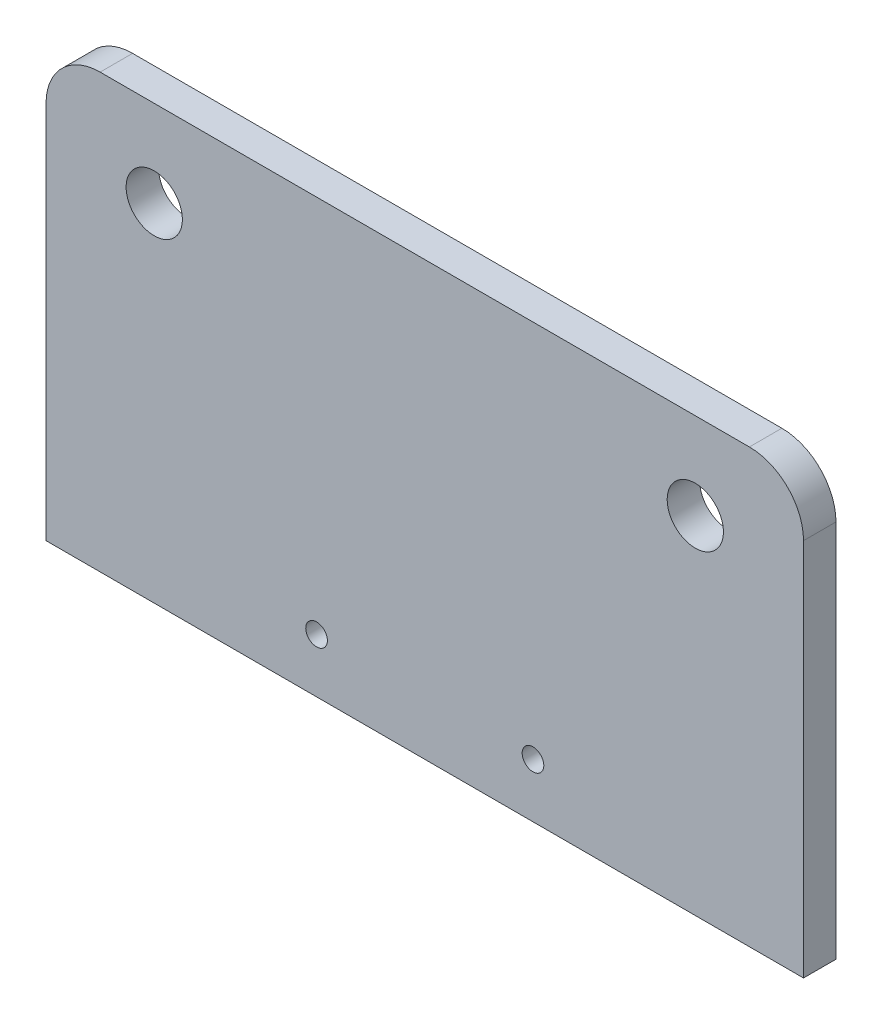
from build123d import *

# Parameters (mm, degrees)
SKETCH_1_R               = 2.6
EXTRUDE_1_DEPTH          = 3
CUT_EXTRUDE_1_DEPTH      = 41.422765863
CUT_EXTRUDE_1_DEPTH_BACK = 41.422765863
SKETCH_2_R               = 1


with BuildPart() as part:
    # Sketch 1 → 凸台-拉伸1 (new body)
    with BuildSketch(Plane.XY):
        with BuildLine():
            Line((-35, -20), (35, -20))
            Line((35, -20), (35, 15))
            ThreePointArc((35, 15), (33.535533906, 18.535533906), (30, 20))
            Line((30, 20), (-30, 20))
            ThreePointArc((-30, 20), (-33.535533906, 18.535533906), (-35, 15))
            Line((-35, 15), (-35, -20))
        make_face()
        with Locations((-25, 12)):
            Circle(SKETCH_1_R, mode=Mode.SUBTRACT)
        with Locations(Location((25, 12, 0), (0, 0, 180))):
            Circle(SKETCH_1_R, mode=Mode.SUBTRACT)
    extrude(amount=EXTRUDE_1_DEPTH)

    # Sketch 2 → 切除-拉伸1 (cut, two sides: drawn at the far end of the back side and taken through both)
    with BuildSketch(Plane(origin=(0, 0, 0), x_dir=(-1, 0, 0), z_dir=(0, 0, -1)).offset(-CUT_EXTRUDE_1_DEPTH_BACK)):
        with Locations((-10, -15)):
            Circle(SKETCH_2_R)
        with Locations((10, -15)):
            Circle(SKETCH_2_R)
    extrude(amount=CUT_EXTRUDE_1_DEPTH + CUT_EXTRUDE_1_DEPTH_BACK, mode=Mode.SUBTRACT)


solid = part.part
